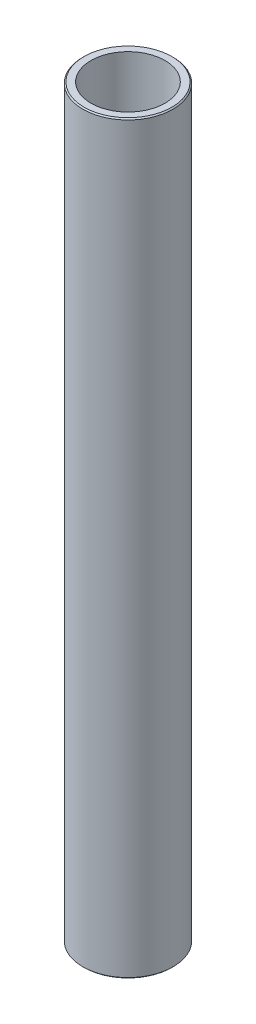
from build123d import *

# Parameters (mm, degrees)
SKETCH1_R           = 35
BOSS_EXTRUDE1_DEPTH = 578.330826449
SKETCH2_R           = 28.745300641
CUT_EXTRUDE1_DEPTH  = 581.445126451
CHAMFER1_SIZE       = 0.916320257


with BuildPart() as part:
    # Sketch1 → Boss-Extrude1 (new body)
    with BuildSketch(Plane(origin=(0, 0, 0), x_dir=(1, 0, 0), z_dir=(0, 1, 0))):
        Circle(SKETCH1_R)
    extrude(amount=BOSS_EXTRUDE1_DEPTH)

    # Sketch2 → Cut-Extrude1 (cut, through all)
    with BuildSketch(Plane(origin=(0, 0, 0), x_dir=(1, 0, 0), z_dir=(0, 1, 0))):
        Circle(SKETCH2_R)
    extrude(amount=CUT_EXTRUDE1_DEPTH, mode=Mode.SUBTRACT)

    # Chamfer1
    chamfer1_edges = [part.edges().sort_by_distance(p)[0] for p in [
        (-35, 578.330826449, 0),
        (-35, 0, 0),
    ]]
    chamfer(chamfer1_edges, length=CHAMFER1_SIZE)


solid = part.part
